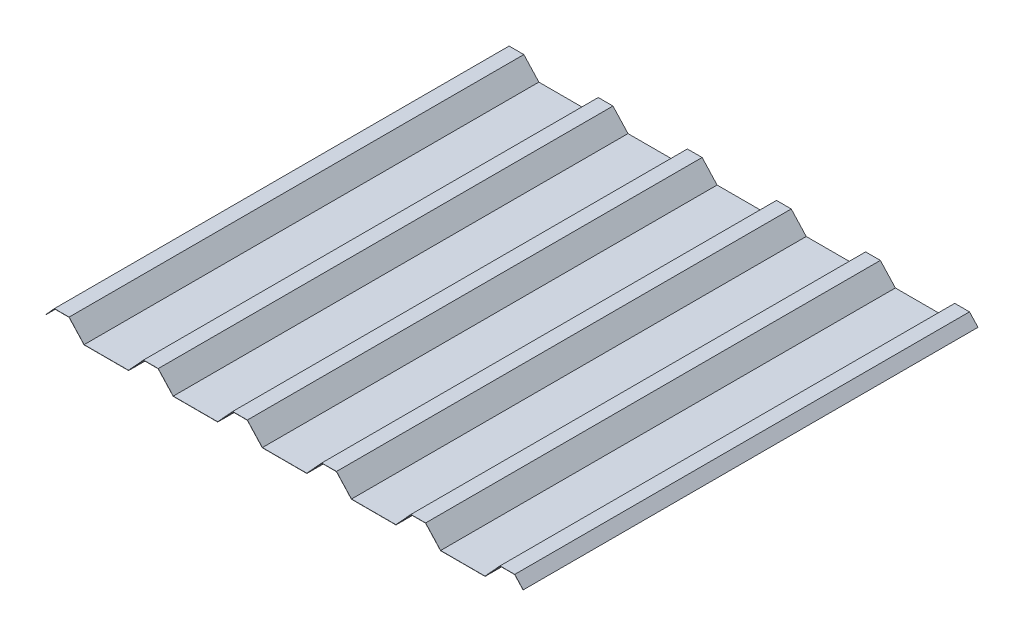
from build123d import *

# Parameters (mm, degrees)
EXTRUS_O_FINA1_DEPTH = 1000


with BuildPart() as part:
    # Esboço1 → Extrusão-Fina1 (new body)
    with BuildSketch(Plane.XY):
        Polygon((-214.272936105, -20), (-196, 0), (-164, 0), (-131, -36), (-33, -36), (0, 0), (32, 0), (65, -36), (163, -36), (196, 0), (228, 0), (261, -36), (359, -36), (392, 0), (424, 0), (457, -36), (555, -36), (588, 0), (620, 0), (653, -36), (751, -36), (784, 0), (816, 0), (834.566797067, -20), (834.933236123, -19.659820021), (816.218071761, 0.5), (783.780049142, 0.5), (750.780049142, -35.5), (653.219950858, -35.5), (620.219950858, 0.5), (587.780049142, 0.5), (554.780049142, -35.5), (457.219950858, -35.5), (424.219950858, 0.5), (391.780049142, 0.5), (358.780049142, -35.5), (261.219950858, -35.5), (228.219950858, 0.5), (195.780049142, 0.5), (162.780049142, -35.5), (65.219950858, -35.5), (32.219950858, 0.5), (-0.219950858, 0.5), (-33.219950858, -35.5), (-130.780049142, -35.5), (-163.780049142, 0.5), (-196.220441406, 0.5), (-214.642067937, -19.66274388), align=None)
    extrude(amount=EXTRUS_O_FINA1_DEPTH)


solid = part.part
